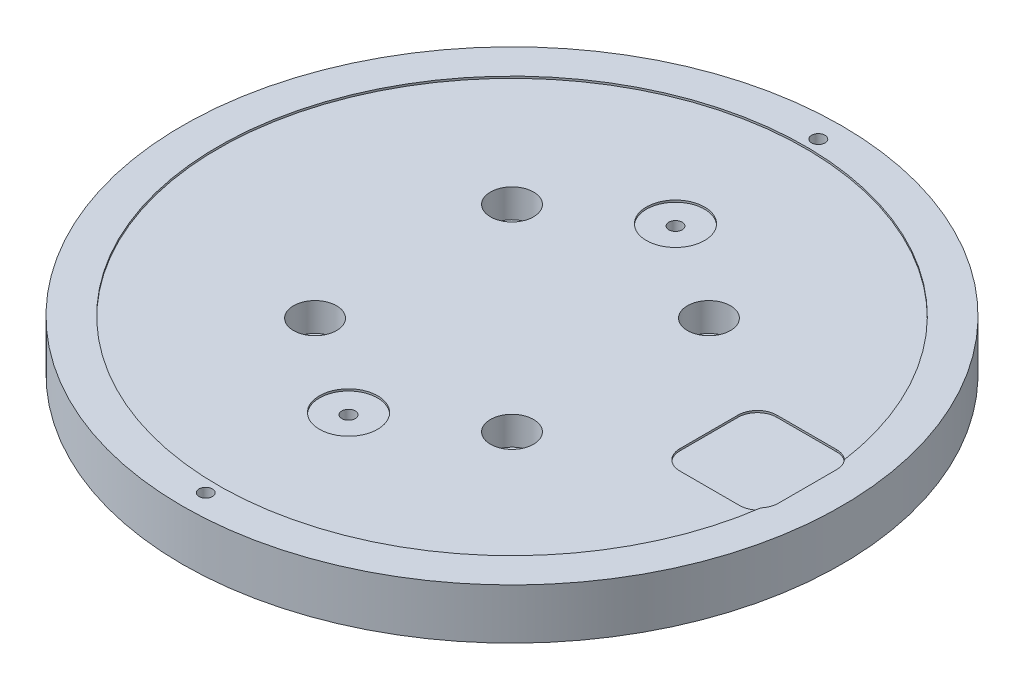
from build123d import *

# Parameters (mm, degrees)
SKETCH1_R                                        = 85
BOSS_EXTRUDE1_DEPTH                              = 13
SKETCH2_R                                        = 75.75
CUT_EXTRUDE1_DEPTH                               = 0.5
CBORE_FOR_1_4_SOCKET_HEAD_CAP_SCREW1_D           = 6.7564
CBORE_FOR_1_4_SOCKET_HEAD_CAP_SCREW1_DEPTH       = 15
CBORE_FOR_1_4_SOCKET_HEAD_CAP_SCREW1_CBORE_D     = 11.1125
CBORE_FOR_1_4_SOCKET_HEAD_CAP_SCREW1_CBORE_DEPTH = 7.349998
CBORE_FOR_1_4_SOCKET_HEAD_CAP_SCREW1_TIP         = 2.029827343
F_8_32_TAPPED_HOLE1_D                            = 3.4544
F_8_32_TAPPED_HOLE1_DEPTH                        = 8
F_8_32_TAPPED_HOLE1_TIP                          = 1.037806461
SKETCH9_W                                        = 25.4
SKETCH9_H                                        = 25
WAFER_TWEEZER_SLOT_DEPTH                         = 1
FILLET1_R                                        = 5
SKETCH10_R                                       = 7.5
CUT_EXTRUDE2_DEPTH                               = 0.5
F_8_32_TAPPED_HOLE2_D                            = 3.4544
F_8_32_TAPPED_HOLE2_DEPTH                        = 8
F_8_32_TAPPED_HOLE2_TIP                          = 1.037806461


with BuildPart() as part:
    # Sketch1 → Boss-Extrude1 (new body)
    with BuildSketch(Plane(origin=(0, 0, 0), x_dir=(1, 0, 0), z_dir=(0, 1, 0))):
        with Locations(Location((0, 0, 0), (0, 0, 270))):
            Circle(SKETCH1_R)
    extrude(amount=-BOSS_EXTRUDE1_DEPTH)

    # Sketch2 → Cut-Extrude1 (cut)
    with BuildSketch(Plane(origin=(0, 0, 0), x_dir=(1, 0, 0), z_dir=(0, 1, 0))):
        with Locations(Location((0, 0, 0), (0, 0, 270))):
            Circle(SKETCH2_R)
    extrude(amount=-CUT_EXTRUDE1_DEPTH, mode=Mode.SUBTRACT)

    # CBORE for 1/4 Socket Head Cap Screw1
    with Locations(Plane(origin=(0, -0.5, 0), x_dir=(-1, 0, 0), z_dir=(0, 1, 0))):
        with Locations((25.4, 25.4), (-25.4, 25.4), (-25.4, -25.4), (25.4, -25.4)):
            CounterBoreHole(CBORE_FOR_1_4_SOCKET_HEAD_CAP_SCREW1_D / 2, CBORE_FOR_1_4_SOCKET_HEAD_CAP_SCREW1_CBORE_D / 2, CBORE_FOR_1_4_SOCKET_HEAD_CAP_SCREW1_CBORE_DEPTH, depth=CBORE_FOR_1_4_SOCKET_HEAD_CAP_SCREW1_DEPTH)
            with Locations((0, 0, -(CBORE_FOR_1_4_SOCKET_HEAD_CAP_SCREW1_DEPTH + CBORE_FOR_1_4_SOCKET_HEAD_CAP_SCREW1_TIP / 2))):  # 118° drill point
                Cone(0, CBORE_FOR_1_4_SOCKET_HEAD_CAP_SCREW1_D / 2, CBORE_FOR_1_4_SOCKET_HEAD_CAP_SCREW1_TIP, mode=Mode.SUBTRACT)

    # #8-32 Tapped Hole1
    with Locations(Plane(origin=(0, 0, 0), x_dir=(1, 0, 0), z_dir=(0, 1, 0))):
        with Locations((0, 79), (0, -79)):
            Hole(F_8_32_TAPPED_HOLE1_D / 2, depth=F_8_32_TAPPED_HOLE1_DEPTH)
            with Locations((0, 0, -(F_8_32_TAPPED_HOLE1_DEPTH + F_8_32_TAPPED_HOLE1_TIP / 2))):  # 118° drill point
                Cone(0, F_8_32_TAPPED_HOLE1_D / 2, F_8_32_TAPPED_HOLE1_TIP, mode=Mode.SUBTRACT)

    # Sketch9 → wafer_tweezer_slot (cut)
    with BuildSketch(Plane(origin=(0, 0, 0), x_dir=(1, 0, 0), z_dir=(0, 1, 0))):
        with Locations((63.5, 0)):
            Rectangle(SKETCH9_W, SKETCH9_H)
    extrude(amount=-WAFER_TWEEZER_SLOT_DEPTH, mode=Mode.SUBTRACT)

    # Fillet1
    # the kernel refuses this fillet: 5 mm, written as the material it adds along each edge
    with BuildSketch(Plane(origin=(76.2, 0, -12.5), x_dir=(0, 0, 1), z_dir=(0, -1, 0))) as fillet1_piece_1_section:
        with BuildLine():
            CenterArc((FILLET1_R, FILLET1_R), FILLET1_R, 180, 90)
            Line((0, FILLET1_R), (0, 0))
            Line((0, 0), (FILLET1_R, 0))
        make_face()
    fillet1_piece_1 = extrude(amount=1, mode=Mode.PRIVATE)
    fillet1_piece_1 = fillet1_piece_1 - Plane(origin=(0, -0.25, 0), x_dir=(0, 0, 1), z_dir=(0, 1, 0)) * Cylinder(75.75, 23, mode=Mode.PRIVATE)
    add(fillet1_piece_1)
    with BuildSketch(Plane(origin=(76.2, 12.5, -12.5), x_dir=(0, 0, 1), z_dir=(0, -1, 0))) as fillet1_piece_2_section:
        with BuildLine():
            CenterArc((FILLET1_R, FILLET1_R), FILLET1_R, 180, 90)
            Line((0, FILLET1_R), (0, 0))
            Line((0, 0), (FILLET1_R, 0))
        make_face()
    fillet1_piece_2 = extrude(amount=13.5, mode=Mode.PRIVATE)
    fillet1_piece_2 = split(fillet1_piece_2, bisect_by=Plane(origin=(73.966184718, -0.5, -12.010793602), z_dir=(0, -1, 0)), keep=Keep.TOP, mode=Mode.PRIVATE)
    add(fillet1_piece_2)
    with BuildSketch(Plane(origin=(76.2, 0, 12.5), x_dir=(0, 0, -1), z_dir=(0, -1, 0))) as fillet1_piece_3_section:
        with BuildLine():
            CenterArc((FILLET1_R, -FILLET1_R), FILLET1_R, 90, 90)
            Line((0, -FILLET1_R), (0, 0))
            Line((0, 0), (FILLET1_R, 0))
        make_face()
    fillet1_piece_3 = extrude(amount=1, mode=Mode.PRIVATE)
    fillet1_piece_3 = fillet1_piece_3 - Plane(origin=(0, -0.25, 0), x_dir=(0, 0, 1), z_dir=(0, 1, 0)) * Cylinder(75.75, 22, mode=Mode.PRIVATE)
    add(fillet1_piece_3)
    with BuildSketch(Plane(origin=(76.2, 12.5, 12.5), x_dir=(0, 0, -1), z_dir=(0, -1, 0))) as fillet1_piece_4_section:
        with BuildLine():
            CenterArc((FILLET1_R, -FILLET1_R), FILLET1_R, 90, 90)
            Line((0, -FILLET1_R), (0, 0))
            Line((0, 0), (FILLET1_R, 0))
        make_face()
    fillet1_piece_4 = extrude(amount=13.5, mode=Mode.PRIVATE)
    fillet1_piece_4 = split(fillet1_piece_4, bisect_by=Plane(origin=(73.966184718, -0.5, 12.010793602), z_dir=(0, -1, 0)), keep=Keep.TOP, mode=Mode.PRIVATE)
    add(fillet1_piece_4)
    with BuildSketch(Plane(origin=(50.8, -0.5, 12.5), x_dir=(0, 0, -1), z_dir=(0, -1, 0))) as fillet1_piece_5:
        with BuildLine():
            CenterArc((FILLET1_R, FILLET1_R), FILLET1_R, 180, 90)
            Line((0, FILLET1_R), (0, 0))
            Line((0, 0), (FILLET1_R, 0))
        make_face()
    extrude(amount=0.5)
    with BuildSketch(Plane(origin=(50.8, -0.5, -12.5), x_dir=(0, 0, 1), z_dir=(0, -1, 0))) as fillet1_piece_6:
        with BuildLine():
            CenterArc((FILLET1_R, -FILLET1_R), FILLET1_R, 90, 90)
            Line((0, -FILLET1_R), (0, 0))
            Line((0, 0), (FILLET1_R, 0))
        make_face()
    extrude(amount=0.5)

    # Sketch10 → Cut-Extrude2 (cut)
    with BuildSketch(Plane(origin=(0, -0.5, 0), x_dir=(1, 0, 0), z_dir=(0, 1, 0))):
        with Locations(Location((0, -42.164, 0), (0, 0, 270))):
            Circle(SKETCH10_R)
        with Locations(Location((0, 42.164, 0), (0, 0, 270))):
            Circle(SKETCH10_R)
    extrude(amount=-CUT_EXTRUDE2_DEPTH, mode=Mode.SUBTRACT)

    # #8-32 Tapped Hole2
    with Locations(Plane(origin=(0, -1, 0), x_dir=(1, 0, 0), z_dir=(0, 1, 0))):
        with Locations((0, 42.164), (0, -42.164)):
            Hole(F_8_32_TAPPED_HOLE2_D / 2, depth=F_8_32_TAPPED_HOLE2_DEPTH)
            with Locations((0, 0, -(F_8_32_TAPPED_HOLE2_DEPTH + F_8_32_TAPPED_HOLE2_TIP / 2))):  # 118° drill point
                Cone(0, F_8_32_TAPPED_HOLE2_D / 2, F_8_32_TAPPED_HOLE2_TIP, mode=Mode.SUBTRACT)


solid = part.part
